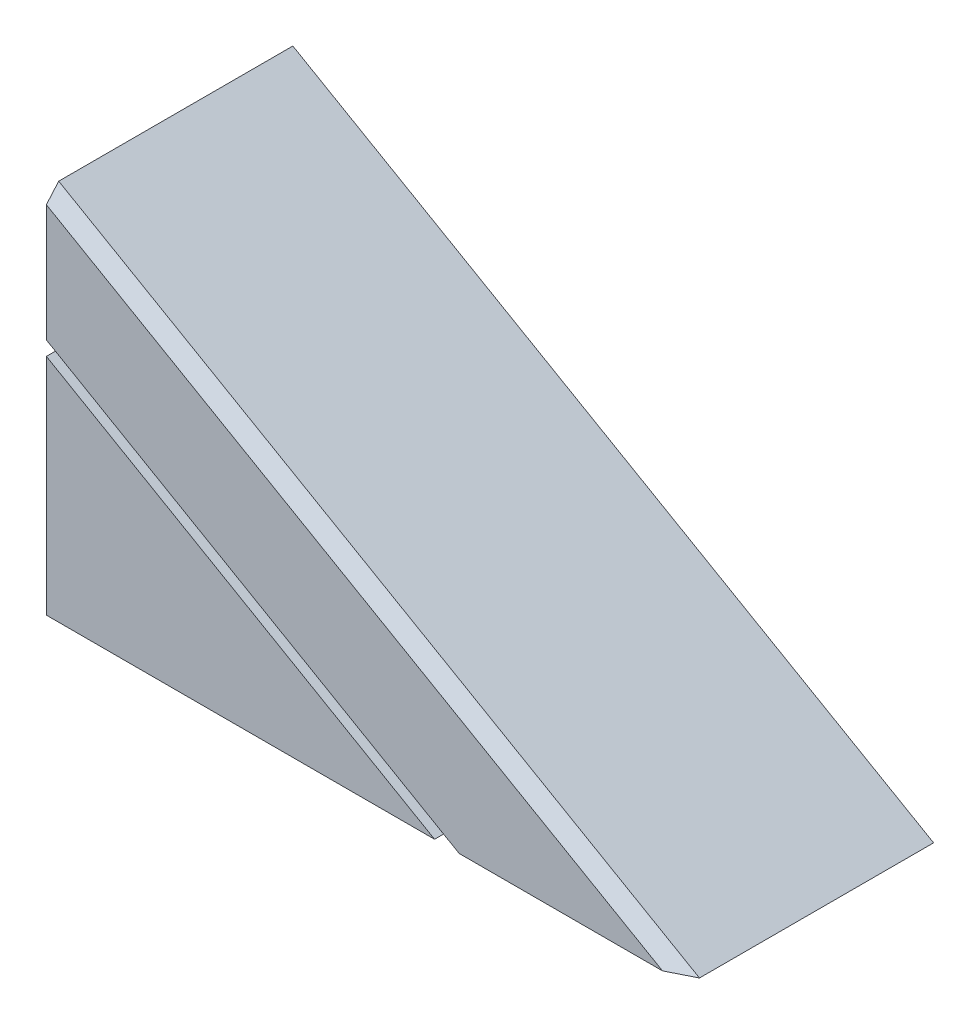
from build123d import *

# Parameters (mm, degrees)
BOSS_EXTRUDE1_DEPTH  = 4
CUT_SWEEP1_START     = 3.150069302
CUT_SWEEP1_OUTLINE_W = 8
CUT_SWEEP1_OUTLINE_H = 2
CUT_SWEEP1_DEPTH     = 0.2000044
CHAMFER1_SIZE        = 0.2


# Read off the part's stored shape, not the designer's step: Cut-Sweep1
with BuildPart() as part:
    # Sketch1 → Boss-Extrude1 (new body)
    with BuildSketch(Plane.XY):
        Polygon((0, 0), (10.4, 0), (0, 6), align=None)
    extrude(amount=BOSS_EXTRUDE1_DEPTH)

    # Cut-Sweep1 outline → Cut-Sweep1 (cut)
    with BuildSketch(Plane(origin=(0, 0, 0), x_dir=(0.866019052628739, -0.5000110003630132, 0), z_dir=(0.5000110003630132, 0.8660190526287392, 0)).offset(CUT_SWEEP1_START)):
        with Locations((2, -3)):
            Rectangle(CUT_SWEEP1_OUTLINE_W, CUT_SWEEP1_OUTLINE_H)
    extrude(amount=CUT_SWEEP1_DEPTH, mode=Mode.SUBTRACT)

    # Chamfer1
    chamfer1_edges = [part.edges().sort_by_distance(p)[0] for p in [
        (5.2, 3, 4),
    ]]
    chamfer(chamfer1_edges, length=CHAMFER1_SIZE)


solid = part.part
